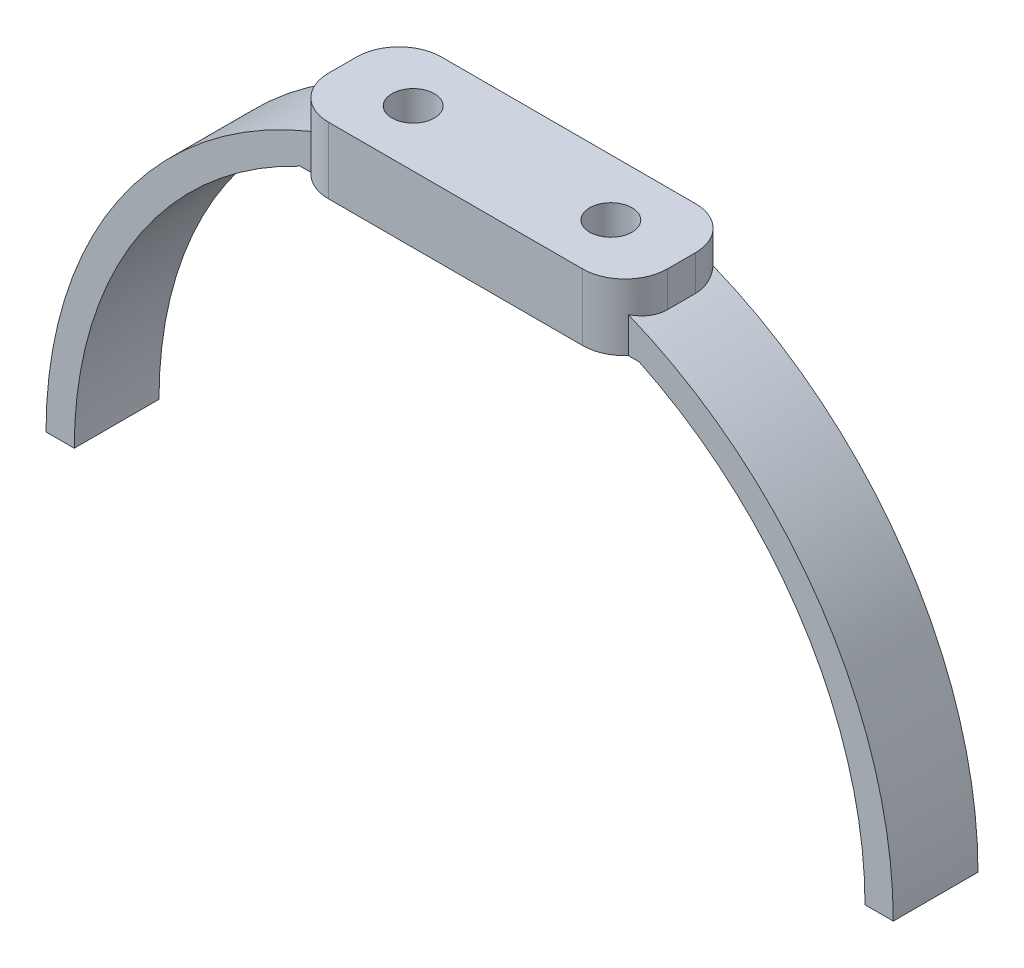
from build123d import *

# Parameters (mm, degrees)
SKETCH_2_W           = 24
SKETCH_2_H           = 8
EXTRUDE_1_DEPTH      = 1
EXTRUDE_3_DEPTH      = 3
EXTRUDE_3_DEPTH_BACK = 3
EXTRUDE_5_REACH      = 45.174
SKETCH_7_W           = 24
SKETCH_7_H           = 4.701778719
SKETCH_3_R           = 1.5
CUT_EXTRUDE_1_DEPTH  = 43.614551505
FILLET_1_R           = 3


with BuildPart() as part:
    # 草图2 → 凸台-拉伸1 (new body)
    with BuildSketch(Plane(origin=(0, 0, 0), x_dir=(1, 0, 0), z_dir=(0, 1, 0))):
        Rectangle(SKETCH_2_W, SKETCH_2_H)
    extrude(amount=-EXTRUDE_1_DEPTH)

    # 凸台-拉伸5: up to this face of the body (flat: up to its plane)
    extrude_5_end = Plane(part.part.faces().sort_by_distance((0, -0.5, -4))[0])
    # 草图7 → 凸台-拉伸5 (add, up to the picked face)
    with BuildSketch(Plane.XY.offset(4), mode=Mode.PRIVATE) as extrude_5_sk1:
        with Locations((0, -2.350889359)):
            Rectangle(SKETCH_7_W, SKETCH_7_H)
    extrude_5_tool1 = split(extrude(extrude_5_sk1.sketch, amount=-EXTRUDE_5_REACH, mode=Mode.PRIVATE), bisect_by=extrude_5_end, keep=Keep.BOTH, mode=Mode.PRIVATE)


with BuildPart() as body_2:
    # 草图5 → 凸台-拉伸3 (new, two sides: drawn at the far end of the back side and taken through both)
    with BuildSketch(Plane.XY.offset(-EXTRUDE_3_DEPTH_BACK)):
        with BuildLine():
            ThreePointArc((30, -30), (21.213203436, -8.786796564), (0, 0))
            Line((0, 0), (0, -2))
            ThreePointArc((0, -2), (19.798989873, -10.201010127), (28, -30))
            Line((28, -30), (30, -30))
        make_face()
        with BuildLine():
            Line((0, -2), (0, 0))
            ThreePointArc((0, 0), (-21.213203436, -8.786796564), (-30, -30))
            Line((-30, -30), (-28, -30))
            ThreePointArc((-28, -30), (-19.798989873, -10.201010127), (0, -2))
        make_face()
    extrude(amount=EXTRUDE_3_DEPTH + EXTRUDE_3_DEPTH_BACK)


with BuildPart() as part_1:
    add(part.part)

    add(body_2.part)  # 凸台-拉伸5 merges body 2
    add(extrude_5_tool1.solids().sort_by(Axis((0, -2.350889, 4), (0, 0, -1)))[0])

    # 草图3 → 切除-拉伸1 (cut, through all)
    with BuildSketch(Plane(origin=(0, 0, 0), x_dir=(1, 0, 0), z_dir=(0, 1, 0))):
        with Locations(Location((-7, 0, 0), (0, 0, 270))):
            Circle(SKETCH_3_R)
        with Locations(Location((7, 0, 0), (0, 0, 270))):
            Circle(SKETCH_3_R)
    extrude(amount=-CUT_EXTRUDE_1_DEPTH, mode=Mode.SUBTRACT)

    # 圆角1
    # the kernel refuses this fillet: 3 mm, written as the material it takes off along each edge
    with BuildSketch(Plane(origin=(-12, -12.201778719, 4), x_dir=(0, 0, -1), z_dir=(0, 1, 0))) as fillet_1_piece_1_section:
        with BuildLine():
            CenterArc((FILLET_1_R, -FILLET_1_R), FILLET_1_R, 90, 90)
            Line((0, -FILLET_1_R), (0, 0))
            Line((0, 0), (FILLET_1_R, 0))
        make_face()
    fillet_1_piece_1 = extrude(amount=19.701778719, mode=Mode.PRIVATE)
    fillet_1_piece_1 = split(fillet_1_piece_1, bisect_by=Plane(origin=(-10.804220272, -4.438855897, 3), z_dir=(0, 0, 1)), keep=Keep.TOP, mode=Mode.PRIVATE)
    add(fillet_1_piece_1, mode=Mode.SUBTRACT)
    with BuildSketch(Plane(origin=(-12, -12.201778719, 4), x_dir=(0, 0, -1), z_dir=(0, 1, 0))) as fillet_1_piece_2_section:
        with BuildLine():
            CenterArc((FILLET_1_R, -FILLET_1_R), FILLET_1_R, 90, 90)
            Line((0, -FILLET_1_R), (0, 0))
            Line((0, 0), (FILLET_1_R, 0))
        make_face()
    fillet_1_piece_2 = extrude(amount=19.701778719, mode=Mode.PRIVATE)
    fillet_1_piece_2 = fillet_1_piece_2 - Plane(origin=(0, -30, 2.5069518), x_dir=(1, 0, 0), z_dir=(0, 0, -1)) * Cylinder(30, 52, mode=Mode.PRIVATE)
    add(fillet_1_piece_2, mode=Mode.SUBTRACT)
    with BuildSketch(Plane(origin=(-12, -12.201778719, -4), x_dir=(1, 0, 0), z_dir=(0, 1, 0))) as fillet_1_piece_3_section:
        with BuildLine():
            CenterArc((FILLET_1_R, -FILLET_1_R), FILLET_1_R, 90, 90)
            Line((0, -FILLET_1_R), (0, 0))
            Line((0, 0), (FILLET_1_R, 0))
        make_face()
    fillet_1_piece_3 = extrude(amount=19.701778719, mode=Mode.PRIVATE)
    fillet_1_piece_3 = split(fillet_1_piece_3, bisect_by=Plane(origin=(-10.804220065, -4.438855826, -3), z_dir=(0, 0, -1)), keep=Keep.TOP, mode=Mode.PRIVATE)
    add(fillet_1_piece_3, mode=Mode.SUBTRACT)
    with BuildSketch(Plane(origin=(-12, -12.201778719, -4), x_dir=(1, 0, 0), z_dir=(0, 1, 0))) as fillet_1_piece_4_section:
        with BuildLine():
            CenterArc((FILLET_1_R, -FILLET_1_R), FILLET_1_R, 90, 90)
            Line((0, -FILLET_1_R), (0, 0))
            Line((0, 0), (FILLET_1_R, 0))
        make_face()
    fillet_1_piece_4 = extrude(amount=19.701778719, mode=Mode.PRIVATE)
    fillet_1_piece_4 = fillet_1_piece_4 - Plane(origin=(0, -30, -2.506951801), x_dir=(1, 0, 0), z_dir=(0, 0, -1)) * Cylinder(30, 52, mode=Mode.PRIVATE)
    add(fillet_1_piece_4, mode=Mode.SUBTRACT)
    with BuildSketch(Plane(origin=(12, 7.5, 4), x_dir=(0, 0, -1), z_dir=(0, -1, 0))) as fillet_1_piece_5_section:
        with BuildLine():
            CenterArc((FILLET_1_R, -FILLET_1_R), FILLET_1_R, 90, 90)
            Line((0, -FILLET_1_R), (0, 0))
            Line((0, 0), (FILLET_1_R, 0))
        make_face()
    fillet_1_piece_5 = extrude(amount=19.701778719, mode=Mode.PRIVATE)
    fillet_1_piece_5 = fillet_1_piece_5 - Plane(origin=(0, -30, 2.506951802), x_dir=(1, 0, 0), z_dir=(0, 0, -1)) * Cylinder(30, 52, mode=Mode.PRIVATE)
    add(fillet_1_piece_5, mode=Mode.SUBTRACT)
    with BuildSketch(Plane(origin=(12, 7.5, 4), x_dir=(0, 0, -1), z_dir=(0, -1, 0))) as fillet_1_piece_6_section:
        with BuildLine():
            CenterArc((FILLET_1_R, -FILLET_1_R), FILLET_1_R, 90, 90)
            Line((0, -FILLET_1_R), (0, 0))
            Line((0, 0), (FILLET_1_R, 0))
        make_face()
    fillet_1_piece_6 = extrude(amount=19.701778719, mode=Mode.PRIVATE)
    fillet_1_piece_6 = split(fillet_1_piece_6, bisect_by=Plane(origin=(11.186935792, -3.254885209, 3), z_dir=(0, 0, 1)), keep=Keep.TOP, mode=Mode.PRIVATE)
    add(fillet_1_piece_6, mode=Mode.SUBTRACT)
    with BuildSketch(Plane(origin=(12, 7.5, -4), x_dir=(-1, 0, 0), z_dir=(0, -1, 0))) as fillet_1_piece_7_section:
        with BuildLine():
            CenterArc((FILLET_1_R, -FILLET_1_R), FILLET_1_R, 90, 90)
            Line((0, -FILLET_1_R), (0, 0))
            Line((0, 0), (FILLET_1_R, 0))
        make_face()
    fillet_1_piece_7 = extrude(amount=19.701778719, mode=Mode.PRIVATE)
    fillet_1_piece_7 = split(fillet_1_piece_7, bisect_by=Plane(origin=(11.240609722, -1.095811506, -3), z_dir=(0, 0, -1)), keep=Keep.TOP, mode=Mode.PRIVATE)
    add(fillet_1_piece_7, mode=Mode.SUBTRACT)
    with BuildSketch(Plane(origin=(12, 7.5, -4), x_dir=(-1, 0, 0), z_dir=(0, -1, 0))) as fillet_1_piece_8_section:
        with BuildLine():
            CenterArc((FILLET_1_R, -FILLET_1_R), FILLET_1_R, 90, 90)
            Line((0, -FILLET_1_R), (0, 0))
            Line((0, 0), (FILLET_1_R, 0))
        make_face()
    fillet_1_piece_8 = extrude(amount=19.701778719, mode=Mode.PRIVATE)
    fillet_1_piece_8 = fillet_1_piece_8 - Plane(origin=(0, -30, -2.506951802), x_dir=(1, 0, 0), z_dir=(0, 0, -1)) * Cylinder(30, 52, mode=Mode.PRIVATE)
    add(fillet_1_piece_8, mode=Mode.SUBTRACT)


solid = part_1.part
